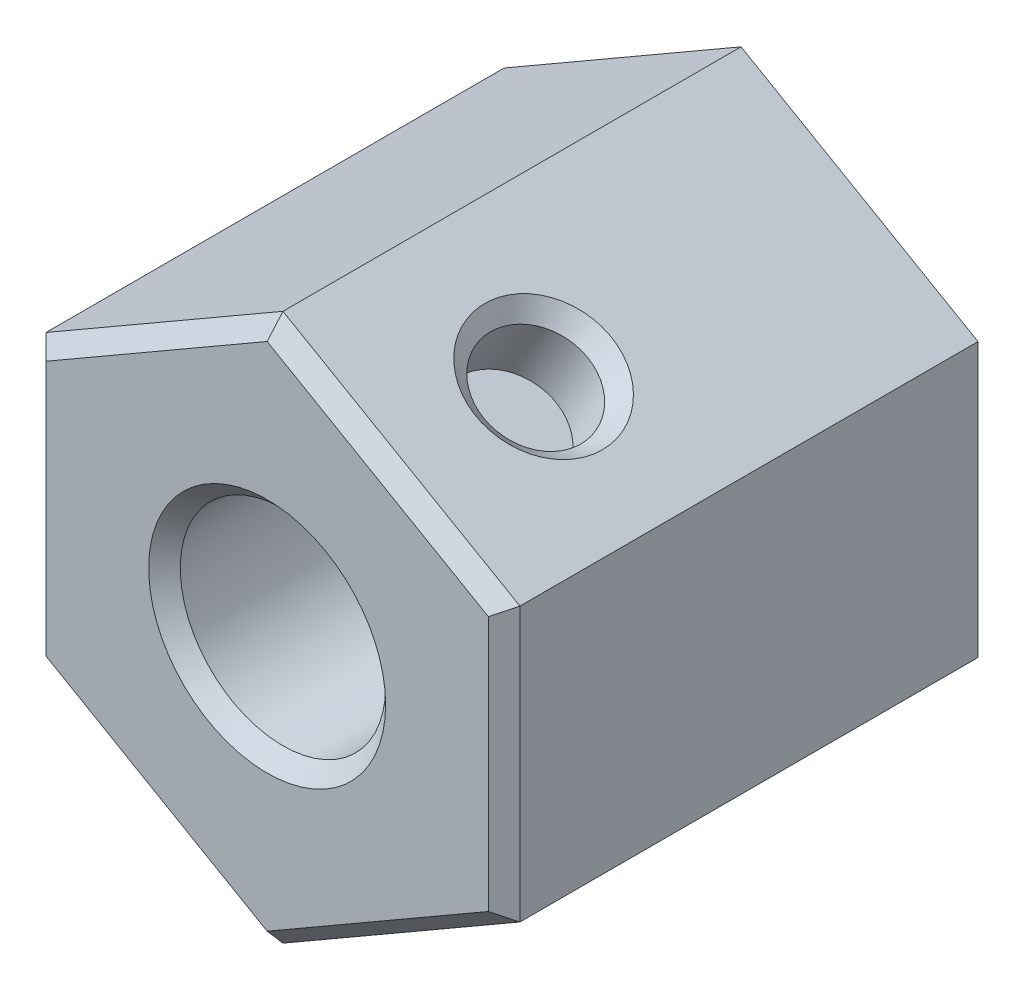
from build123d import *

# Parameters (mm, degrees)
BOSS_EXTRUDE1_DEPTH = 15
SKETCH2_R           = 3.25
CUT_EXTRUDE1_DEPTH  = 15
CUT_EXTRUDE2_DEPTH  = 2.5
SKETCH4_R           = 1.65
CUT_EXTRUDE3_DEPTH  = 2.5
CIRPATTERN1_COUNT   = 3
CHAMFER1_SIZE       = 0.5
CHAMFER2_SIZE       = 0.5
CHAMFER3_SIZE       = 0.5


with BuildPart() as part:
    # Sketch1 → Boss-Extrude1 (new body)
    with BuildSketch(Plane.XY):
        Polygon((0, 8.660254038), (-7.5, 4.330127019), (-7.5, -4.330127019), (0, -8.660254038), (7.5, -4.330127019), (7.5, 4.330127019), align=None)
    extrude(amount=BOSS_EXTRUDE1_DEPTH)

    # Sketch2 → Cut-Extrude1 (cut)
    with BuildSketch(Plane.XY.offset(15)):
        Circle(SKETCH2_R)
    extrude(amount=-CUT_EXTRUDE1_DEPTH, mode=Mode.SUBTRACT)

    # Sketch3 → Cut-Extrude2 (cut)
    with BuildSketch(Plane(origin=(0, 0, 0), x_dir=(-1, 0, 0), z_dir=(0, 0, -1))):
        Polygon((0, 5.888972746), (-5.1, 2.944486373), (-5.1, -2.944486373), (0, -5.888972746), (5.1, -2.944486373), (5.1, 2.944486373), align=None)
    extrude(amount=-CUT_EXTRUDE2_DEPTH, mode=Mode.SUBTRACT)

    # Sketch4 → Cut-Extrude3 (cut)
    with BuildSketch(Plane(origin=(3.75, 6.495190528, 0), x_dir=(0.8660254037844417, -0.4999999999999949, 0), z_dir=(0.4999999999999949, 0.8660254037844417, 0))):
        with Locations((0, -10)):
            Circle(SKETCH4_R)
    cut_extrude3 = extrude(amount=-CUT_EXTRUDE3_DEPTH, mode=Mode.SUBTRACT)

    # CirPattern1: Cut-Extrude3 ×3 about axis
    cirpattern1_axis = Axis((0, 0, 15), (0, 0, 1))
    for i in range(1, CIRPATTERN1_COUNT):
        add(cut_extrude3.rotate(cirpattern1_axis, i * 360 / CIRPATTERN1_COUNT), mode=Mode.SUBTRACT)

    # Chamfer1
    chamfer1_edges = [part.edges().sort_by_distance(p)[0] for p in [
        (7.5, 0, 15),
        (3.75, -6.495190528, 15),
        (-3.75, -6.495190528, 15),
        (-7.5, 0, 15),
        (-3.75, 6.495190528, 15),
        (3.75, 6.495190528, 15),
        (-3.25, 0, 15),
    ]]
    chamfer(chamfer1_edges, length=CHAMFER1_SIZE)

    # Chamfer2
    chamfer2_edges = [part.edges().sort_by_distance(p)[0] for p in [
        (-7.5, -1.65, 10),
        (5.178941916, -5.670190528, 10),
        (2.321058084, 7.320190528, 10),
    ]]
    chamfer(chamfer2_edges, length=CHAMFER2_SIZE)

    # Chamfer3
    chamfer3_edges = [part.edges().sort_by_distance(p)[0] for p in [
        (-3.25, 0, 2.5),
    ]]
    chamfer(chamfer3_edges, length=CHAMFER3_SIZE)


solid = part.part
